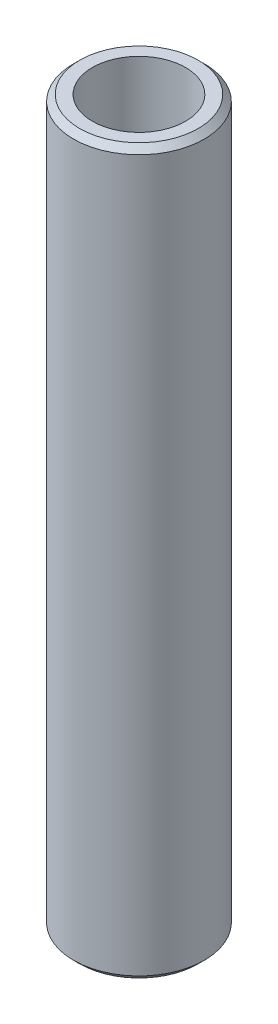
from build123d import *

# Parameters (mm, degrees)
SKETCH1_R           = 22.5
BOSS_EXTRUDE1_DEPTH = 249.069710008
SKETCH2_R           = 16.047905525
CUT_EXTRUDE1_DEPTH  = 252.094047009
CHAMFER1_SIZE       = 2.102073274


with BuildPart() as part:
    # Sketch1 → Boss-Extrude1 (new body)
    with BuildSketch(Plane(origin=(0, 0, 0), x_dir=(1, 0, 0), z_dir=(0, 1, 0))):
        Circle(SKETCH1_R)
    extrude(amount=BOSS_EXTRUDE1_DEPTH)

    # Sketch2 → Cut-Extrude1 (cut, through all)
    with BuildSketch(Plane(origin=(0, 0, 0), x_dir=(1, 0, 0), z_dir=(0, 1, 0))):
        Circle(SKETCH2_R)
    extrude(amount=CUT_EXTRUDE1_DEPTH, mode=Mode.SUBTRACT)

    # Chamfer1
    chamfer1_edges = [part.edges().sort_by_distance(p)[0] for p in [
        (-22.5, 249.069710008, 0),
        (-22.5, 0, 0),
    ]]
    chamfer(chamfer1_edges, length=CHAMFER1_SIZE)


solid = part.part
